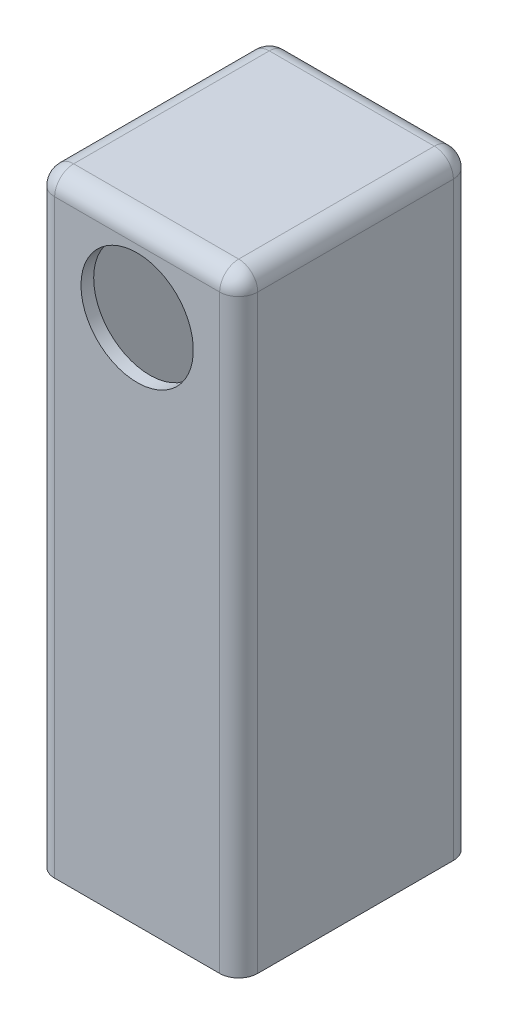
from build123d import *

# Parameters (mm, degrees)
SKETCH2_W           = 140
SKETCH2_H           = 164.092615239
BOSS_EXTRUDE1_DEPTH = 469.9
SHELL1_T            = 10
FILLET2_R           = 15
SKETCH4_R           = 44.25
CUT_EXTRUDE2_DEPTH  = 10


with BuildPart() as part:
    # Sketch2 → Boss-Extrude1 (new body)
    with BuildSketch(Plane(origin=(0, 0, 0), x_dir=(1, 0, 0), z_dir=(0, 1, 0))):
        with Locations((0, 12.04630762)):
            Rectangle(SKETCH2_W, SKETCH2_H)
    extrude(amount=-BOSS_EXTRUDE1_DEPTH)

    # Shell1
    shell1_openings = [part.faces().sort_by_distance(p)[0] for p in [
        (0, -469.9, -12.046307619),
    ]]
    offset(amount=SHELL1_T, openings=shell1_openings, kind=Kind.INTERSECTION)

    # Fillet2
    # the kernel refuses this fillet: 15 mm, written as the material it takes off along each edge
    with BuildSketch(Plane(origin=(65, -5, 65), x_dir=(0, 1, 0), z_dir=(1, 0, 0))) as fillet2_piece_1_section:
        Polygon((0, 0), (FILLET2_R, 0), (FILLET2_R, FILLET2_R), (0, FILLET2_R), align=None)
    fillet2_piece_1 = extrude(amount=FILLET2_R, mode=Mode.PRIVATE)
    fillet2_piece_1 = fillet2_piece_1 - Plane(origin=(65, -5, 65), x_dir=(0, -0.7071067811865475, -0.7071067811865475), z_dir=(1, 0, 0)) * Sphere(FILLET2_R, mode=Mode.PRIVATE)
    add(fillet2_piece_1, mode=Mode.SUBTRACT)
    with BuildSketch(Plane(origin=(-65, -5, 65), x_dir=(0, 0, 1), z_dir=(0, 1, 0))) as fillet2_piece_2_section:
        Polygon((0, 0), (FILLET2_R, 0), (FILLET2_R, -FILLET2_R), (0, -FILLET2_R), align=None)
    fillet2_piece_2 = extrude(amount=FILLET2_R, mode=Mode.PRIVATE)
    fillet2_piece_2 = fillet2_piece_2 - Plane(origin=(-65, -5, 65), x_dir=(0.7071067811865475, 0, -0.7071067811865475), z_dir=(0, 1, 0)) * Sphere(FILLET2_R, mode=Mode.PRIVATE)
    add(fillet2_piece_2, mode=Mode.SUBTRACT)
    with BuildSketch(Plane(origin=(-65, -5, -89.092615239), x_dir=(0, 1, 0), z_dir=(0, 0, -1))) as fillet2_piece_3_section:
        Polygon((0, 0), (FILLET2_R, 0), (FILLET2_R, -FILLET2_R), (0, -FILLET2_R), align=None)
    fillet2_piece_3 = extrude(amount=FILLET2_R, mode=Mode.PRIVATE)
    fillet2_piece_3 = fillet2_piece_3 - Plane(origin=(-65, -5, -89.092615239), x_dir=(0.7071067811865475, -0.7071067811865475, 0), z_dir=(0, 0, -1)) * Sphere(FILLET2_R, mode=Mode.PRIVATE)
    add(fillet2_piece_3, mode=Mode.SUBTRACT)
    with BuildSketch(Plane(origin=(65, -5, -89.092615239), x_dir=(1, 0, 0), z_dir=(0, 0, -1))) as fillet2_piece_4_section:
        Polygon((0, 0), (FILLET2_R, 0), (FILLET2_R, -FILLET2_R), (0, -FILLET2_R), align=None)
    fillet2_piece_4 = extrude(amount=FILLET2_R, mode=Mode.PRIVATE)
    fillet2_piece_4 = fillet2_piece_4 - Plane(origin=(65, -5, -89.092615239), x_dir=(-0.7071067811865475, -0.7071067811865475, 0), z_dir=(0, 0, -1)) * Sphere(FILLET2_R, mode=Mode.PRIVATE)
    add(fillet2_piece_4, mode=Mode.SUBTRACT)
    with BuildSketch(Plane(origin=(65, 10, 80), x_dir=(0, -1, 0), z_dir=(-1, 0, 0)), Plane(origin=(-65, 10, -104.092615239), x_dir=(0, -1, 0), z_dir=(1, 0, 0))) as fillet2_piece_5:
        with BuildLine():
            CenterArc((FILLET2_R, -FILLET2_R), FILLET2_R, 90, 90)
            Line((0, -FILLET2_R), (0, 0))
            Line((0, 0), (FILLET2_R, 0))
        make_face()
    extrude(amount=130, mode=Mode.SUBTRACT)
    with BuildSketch(Plane(origin=(-80, 10, 65), x_dir=(0, -1, 0), z_dir=(0, 0, -1)), Plane(origin=(80, 10, -89.092615239), x_dir=(0, -1, 0), z_dir=(0, 0, 1))) as fillet2_piece_6:
        with BuildLine():
            CenterArc((FILLET2_R, -FILLET2_R), FILLET2_R, 90, 90)
            Line((0, -FILLET2_R), (0, 0))
            Line((0, 0), (FILLET2_R, 0))
        make_face()
    extrude(amount=154.092615239, mode=Mode.SUBTRACT)
    with BuildSketch(Plane(origin=(80, -507.4, 80), x_dir=(-1, 0, 0), z_dir=(0, 1, 0)), Plane(origin=(-80, -5, 80), x_dir=(1, 0, 0), z_dir=(0, -1, 0)), Plane(origin=(-80, -5, -104.092615239), x_dir=(0, 0, 1), z_dir=(0, -1, 0)), Plane(origin=(80, -5, -104.092615239), x_dir=(-1, 0, 0), z_dir=(0, -1, 0))) as fillet2_piece_7:
        with BuildLine():
            CenterArc((FILLET2_R, -FILLET2_R), FILLET2_R, 90, 90)
            Line((0, -FILLET2_R), (0, 0))
            Line((0, 0), (FILLET2_R, 0))
        make_face()
    extrude(amount=502.4, mode=Mode.SUBTRACT)

    # Sketch4 → Cut-Extrude2 (cut)
    with BuildSketch(Plane(origin=(44.675144213, 0, 80), x_dir=(-1, 0, 0), z_dir=(0, 0, -1))):
        with Locations((44.675144213, -55)):
            Circle(SKETCH4_R)
    extrude(amount=CUT_EXTRUDE2_DEPTH, mode=Mode.SUBTRACT)


solid = part.part
